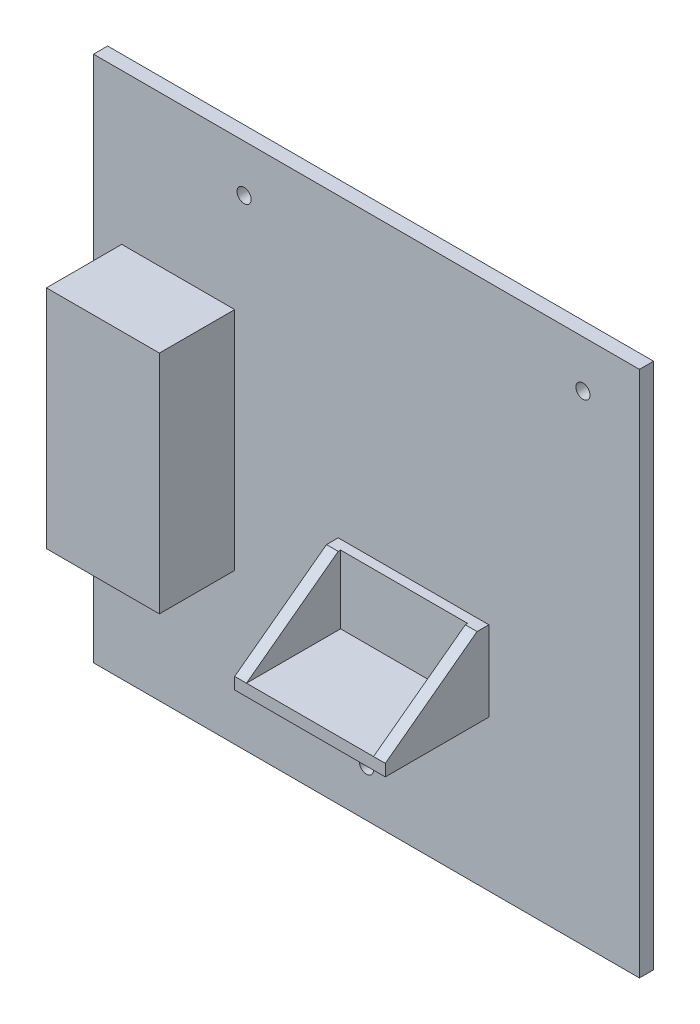
from build123d import *

# Parameters (mm, degrees)
CROQUIS1_W              = 116
CROQUIS1_H              = 112
SALIENTE_EXTRUIR1_DEPTH = 3
CROQUIS2_W              = 24
CROQUIS2_H              = 48
SALIENTE_EXTRUIR2_DEPTH = 16
CROQUIS3_W              = 32
CROQUIS3_H              = 17
SALIENTE_EXTRUIR3_DEPTH = 22
VACIADO1_START          = -21.5
VACIADO1_OUTLINE_W      = 27
VACIADO1_OUTLINE_H      = 22.5
VACIADO1_OUTLINE_W_2    = 19
VACIADO1_OUTLINE_H_2    = 14
VACIADO1_DEPTH          = 14.5
VACIADO1_START_2        = -7
VACIADO1_2_OUTLINE_W    = 19
VACIADO1_2_OUTLINE_H    = 14
VACIADO1_2_DEPTH        = 28.5
CROQUIS5_W              = 27
CROQUIS5_H              = 2.5
SALIENTE_EXTRUIR7_DEPTH = 14.5
CORTAR_EXTRUIR1_DEPTH   = 34.5
CROQUIS7_R              = 1.5
CORTAR_EXTRUIR2_DEPTH   = 34.5


# Read off the part's stored shape, not the designer's step: Vaciado1
with BuildPart() as part:
    # Croquis1 → Saliente-Extruir1 (new body)
    with BuildSketch(Plane.XY):
        Rectangle(CROQUIS1_W, CROQUIS1_H)
    extrude(amount=SALIENTE_EXTRUIR1_DEPTH)

    # Croquis2 → Saliente-Extruir2 (add)
    with BuildSketch(Plane.XY.offset(3)):
        with Locations((-40, 0)):
            Rectangle(CROQUIS2_W, CROQUIS2_H)
    extrude(amount=SALIENTE_EXTRUIR2_DEPTH)

    # Croquis3 → Saliente-Extruir3 (add)
    with BuildSketch(Plane.XY.offset(3)):
        with Locations((10, -15.5)):
            Rectangle(CROQUIS3_W, CROQUIS3_H)
    extrude(amount=SALIENTE_EXTRUIR3_DEPTH)

    # Vaciado1 outline → Vaciado1 (cut)
    with BuildSketch(Plane(origin=(0, 0, 0), x_dir=(1, 0, 0), z_dir=(0, 1, 0)).offset(VACIADO1_START)):
        with Locations((10, -13.75)):
            Rectangle(VACIADO1_OUTLINE_W, VACIADO1_OUTLINE_H)
        with Locations((-40, -9.5)):
            Rectangle(VACIADO1_OUTLINE_W_2, VACIADO1_OUTLINE_H_2)
    extrude(amount=VACIADO1_DEPTH, mode=Mode.SUBTRACT)

    # Vaciado1 2 outline → Vaciado1 2 (cut)
    with BuildSketch(Plane(origin=(0, 0, 0), x_dir=(1, 0, 0), z_dir=(0, 1, 0)).offset(VACIADO1_START_2)):
        with Locations((-40, -9.5)):
            Rectangle(VACIADO1_2_OUTLINE_W, VACIADO1_2_OUTLINE_H)
    extrude(amount=VACIADO1_2_DEPTH, mode=Mode.SUBTRACT)

    # Croquis5 → Saliente-Extruir7 (add)
    with BuildSketch(Plane(origin=(0, -21.5, 0), x_dir=(1, 0, 0), z_dir=(0, 1, 0))):
        with Locations((10, -3.75)):
            Rectangle(CROQUIS5_W, CROQUIS5_H)
    extrude(amount=SALIENTE_EXTRUIR7_DEPTH)

    # Croquis6 → Cortar-Extruir1 (cut)
    with BuildSketch(Plane(origin=(26, 0, 0), x_dir=(0, 0, -1), z_dir=(1, 0, 0))):
        Polygon((-25, -7), (-25, -21.5), (-5.5, -7), align=None)
    extrude(amount=-CORTAR_EXTRUIR1_DEPTH, mode=Mode.SUBTRACT)

    # Croquis7 → Cortar-Extruir2 (cut)
    with BuildSketch(Plane.XY.offset(3)):
        with Locations((-26, 46)):
            Circle(CROQUIS7_R)
        with Locations((46, 46)):
            Circle(CROQUIS7_R)
        with Locations((0, -46)):
            Circle(CROQUIS7_R)
    extrude(amount=-CORTAR_EXTRUIR2_DEPTH, mode=Mode.SUBTRACT)


solid = part.part
